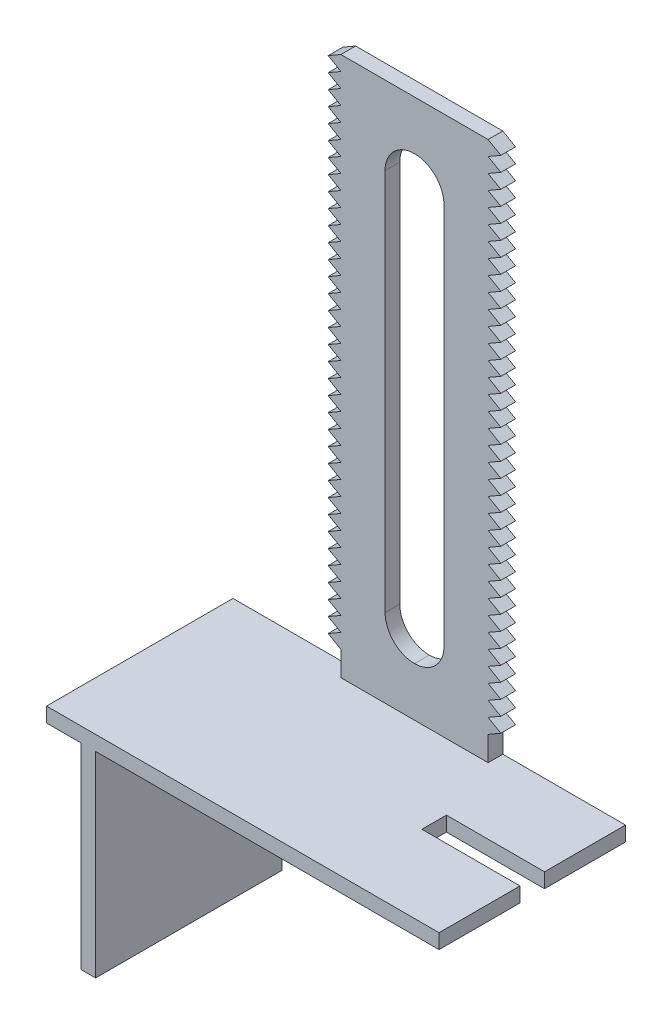
from build123d import *

# Parameters (mm, degrees)
SKETCH2_W            = 30
SKETCH2_H            = 3
BOSS_EXTRUDE1_DEPTH  = 110
BOSS_EXTRUDE2_DEPTH  = 3
SKETCH4_W            = 3
SKETCH4_H            = 3
BOSS_EXTRUDE3_DEPTH  = 3
SKETCH5_W            = 12
SKETCH5_H            = 90
CUT_EXTRUDE1_DEPTH   = 3
FILLET1_R            = 6
SKETCH7_W            = 3
SKETCH7_H            = 3
SKETCH7_W_2          = 6
BOSS_EXTRUDE8_DEPTH  = 10
SKETCH8_W            = 13
SKETCH8_H            = 3
BOSS_EXTRUDE9_DEPTH  = 3
SKETCH9_W            = 13
SKETCH9_H            = 3
BOSS_EXTRUDE10_DEPTH = 3
SKETCH10_W           = 13
SKETCH10_H           = 3
BOSS_EXTRUDE11_DEPTH = 3
SKETCH11_W           = 13
SKETCH11_H           = 3
BOSS_EXTRUDE12_DEPTH = 3
SKETCH12_W           = 13
SKETCH12_H           = 3
BOSS_EXTRUDE13_DEPTH = 25
SKETCH13_W           = 13
SKETCH13_H           = 3
BOSS_EXTRUDE14_DEPTH = 25
SKETCH14_W           = 80
SKETCH14_H           = 3
BOSS_EXTRUDE15_DEPTH = 25
SKETCH15_W           = 3
SKETCH15_H           = 38
BOSS_EXTRUDE16_DEPTH = 40
SKETCH16_W           = 20
SKETCH16_H           = 5
CUT_EXTRUDE2_DEPTH   = 3


with BuildPart() as part:
    # Sketch2 → Boss-Extrude1 (new body)
    with BuildSketch(Plane(origin=(0, 0, 0), x_dir=(1, 0, 0), z_dir=(0, 1, 0))):
        Rectangle(SKETCH2_W, SKETCH2_H)
    extrude(amount=BOSS_EXTRUDE1_DEPTH)

    # Sketch3 → Boss-Extrude2 (add)
    with BuildSketch(Plane.XY.offset(1.5)):
        Polygon((-15, 107), (-15, 110), (-17.598076211, 108.5), align=None)
        Polygon((-15, 104), (-15, 107), (-17.598076211, 105.5), align=None)
        Polygon((-15, 101), (-15, 104), (-17.598076211, 102.5), align=None)
        Polygon((-15, 98), (-15, 101), (-17.598076211, 99.5), align=None)
        Polygon((-15, 95), (-15, 98), (-17.598076211, 96.5), align=None)
        Polygon((-15, 92), (-15, 95), (-17.598076211, 93.5), align=None)
        Polygon((-15, 89), (-15, 92), (-17.598076211, 90.5), align=None)
        Polygon((-15, 86), (-15, 89), (-17.598076211, 87.5), align=None)
        Polygon((-15, 83), (-15, 86), (-17.598076211, 84.5), align=None)
        Polygon((-15, 80), (-15, 83), (-17.598076211, 81.5), align=None)
        Polygon((-15, 77), (-15, 80), (-17.598076211, 78.5), align=None)
        Polygon((17.598076211, 108.5), (15, 110), (15, 107), align=None)
        Polygon((17.598076211, 105.5), (15, 107), (15, 104), align=None)
        Polygon((17.598076211, 102.5), (15, 104), (15, 101), align=None)
        Polygon((17.598076211, 99.5), (15, 101), (15, 98), align=None)
        Polygon((17.598076211, 96.5), (15, 98), (15, 95), align=None)
        Polygon((17.598076211, 93.5), (15, 95), (15, 92), align=None)
        Polygon((17.598076211, 90.5), (15, 92), (15, 89), align=None)
        Polygon((17.598076211, 87.5), (15, 89), (15, 86), align=None)
        Polygon((17.598076211, 84.5), (15, 86), (15, 83), align=None)
        Polygon((17.598076211, 81.5), (15, 83), (15, 80), align=None)
        Polygon((17.598076211, 78.5), (15, 80), (15, 77), align=None)
        Polygon((-15, 74), (-15, 77), (-17.598076211, 75.5), align=None)
        Polygon((-15, 71), (-15, 74), (-17.598076211, 72.5), align=None)
        Polygon((-15, 68), (-15, 71), (-17.598076211, 69.5), align=None)
        Polygon((-15, 65), (-15, 68), (-17.598076211, 66.5), align=None)
        Polygon((-15, 62), (-15, 65), (-17.598076211, 63.5), align=None)
        Polygon((-15, 59), (-15, 62), (-17.598076211, 60.5), align=None)
        Polygon((-15, 56), (-15, 59), (-17.598076211, 57.5), align=None)
        Polygon((-15, 53), (-15, 56), (-17.598076211, 54.5), align=None)
        Polygon((-15, 50), (-15, 53), (-17.598076211, 51.5), align=None)
        Polygon((-15, 47), (-15, 50), (-17.598076211, 48.5), align=None)
        Polygon((-15, 44), (-15, 47), (-17.598076211, 45.5), align=None)
        Polygon((-15, 41), (-15, 44), (-17.598076211, 42.5), align=None)
        Polygon((-15, 38), (-15, 41), (-17.598076211, 39.5), align=None)
        Polygon((-15, 35), (-15, 38), (-17.598076211, 36.5), align=None)
        Polygon((17.598076211, 75.5), (15, 77), (15, 74), align=None)
        Polygon((17.598076211, 69.5), (15, 71), (15, 68), align=None)
        Polygon((17.598076211, 66.5), (15, 68), (15, 65), align=None)
        Polygon((17.598076211, 63.5), (15, 65), (15, 62), align=None)
        Polygon((17.598076211, 51.5), (15, 53), (15, 50), align=None)
        Polygon((17.598076211, 48.5), (15, 50), (15, 47), align=None)
        Polygon((17.598076211, 45.5), (15, 47), (15, 44), align=None)
        Polygon((17.598076211, 42.5), (15, 44), (15, 41), align=None)
        Polygon((17.598076211, 39.5), (15, 41), (15, 38), align=None)
        Polygon((17.598076211, 33.5), (15, 35), (15, 32), align=None)
        Polygon((17.598076211, 30.5), (15, 32), (15, 29), align=None)
        Polygon((-15, 32), (-15, 35), (-17.598076211, 33.5), align=None)
        Polygon((-15, 29), (-15, 32), (-17.598076211, 30.5), align=None)
        Polygon((-15, 26), (-15, 29), (-17.598076211, 27.5), align=None)
        Polygon((-15, 23), (-15, 26), (-17.598076211, 24.5), align=None)
        Polygon((-15, 20), (-15, 23), (-17.598076211, 21.5), align=None)
        Polygon((-15, 17), (-15, 20), (-17.598076211, 18.5), align=None)
        Polygon((17.598076211, 27.5), (15, 29), (15, 26), align=None)
        Polygon((17.598076211, 24.5), (15, 26), (15, 23), align=None)
        Polygon((-15, 14), (-15, 17), (-17.598076211, 15.5), align=None)
        Polygon((17.598076211, 21.5), (15, 23), (15, 20), align=None)
        Polygon((17.598076211, 18.5), (15, 20), (15, 17), align=None)
        Polygon((-15, 11), (-15, 14), (-17.598076211, 12.5), align=None)
        Polygon((17.598076211, 15.5), (15, 17), (15, 14), align=None)
        Polygon((17.598076211, 12.5), (15, 14), (15, 11), align=None)
        Polygon((17.598076211, 9.5), (15, 11), (15, 8), align=None)
        Polygon((17.598076211, 6.5), (15, 8), (15, 5), align=None)
        Polygon((-15, 5), (-15, 8), (-17.598076211, 6.5), align=None)
        Polygon((-15, 8), (-15, 11), (-17.598076211, 9.5), align=None)
        Polygon((15, 74), (17.598076211, 72.5), (15, 71), align=None)
        Polygon((15, 62), (17.598076211, 60.5), (15, 59), align=None)
        Polygon((15, 59), (17.598076211, 57.5), (15, 56), align=None)
        Polygon((15, 56), (17.598076211, 54.5), (15, 53), align=None)
        Polygon((15, 38), (17.598076211, 36.5), (15, 35), align=None)
    extrude(amount=-BOSS_EXTRUDE2_DEPTH)

    # Sketch4 → Boss-Extrude3 (add)
    with BuildSketch(Plane.XY.offset(1.5)):
        Polygon((-6, -3), (-9, -3), (-12, -3), (-15, -3), (-15, -6), (15, -6), (15, -3), (12, -3), (9, -3), (6, -3), (3, -3), (0, -3), (-3, -3), align=None)
        with Locations((-13.5, -1.5)):
            Rectangle(SKETCH4_W, SKETCH4_H)
        with Locations((-7.5, -1.5)):
            Rectangle(SKETCH4_W, SKETCH4_H)
        with Locations((-1.5, -1.5)):
            Rectangle(SKETCH4_W, SKETCH4_H)
        with Locations((1.5, -1.5)):
            Rectangle(SKETCH4_W, SKETCH4_H)
        with Locations((7.5, -1.5)):
            Rectangle(SKETCH4_W, SKETCH4_H)
        with Locations((13.5, -1.5)):
            Rectangle(SKETCH4_W, SKETCH4_H)
    extrude(amount=-BOSS_EXTRUDE3_DEPTH)

    # Sketch5 → Cut-Extrude1 (cut)
    with BuildSketch(Plane(origin=(0, 0, -1.5), x_dir=(-1, 0, 0), z_dir=(0, 0, -1))):
        with Locations((0, 55)):
            Rectangle(SKETCH5_W, SKETCH5_H)
    extrude(amount=-CUT_EXTRUDE1_DEPTH, mode=Mode.SUBTRACT)

    # Fillet1
    fillet1_edges = [part.edges().sort_by_distance(p)[0] for p in [
        (-6, 10, 0),
        (6, 10, 0),
        (6, 100, 0),
        (-6, 100, 0),
    ]]
    fillet(fillet1_edges, radius=FILLET1_R - 0.0001)  # a hair under: the kernel refuses the full size

    # Sketch7 → Boss-Extrude8 (add)
    with BuildSketch(Plane.XY.offset(1.5)):
        with Locations((-13.5, -1.5)):
            Rectangle(SKETCH7_W, SKETCH7_H)
        with Locations((-7.5, -1.5)):
            Rectangle(SKETCH7_W, SKETCH7_H)
        with Locations((0, -1.5)):
            Rectangle(SKETCH7_W_2, SKETCH7_H)
        with Locations((7.5, -1.5)):
            Rectangle(SKETCH7_W, SKETCH7_H)
        with Locations((13.5, -1.5)):
            Rectangle(SKETCH7_W, SKETCH7_H)
    extrude(amount=BOSS_EXTRUDE8_DEPTH)

    # Sketch8 → Boss-Extrude9 (add)
    with BuildSketch(Plane.ZY.offset(9)):
        with Locations((5, -1.5)):
            Rectangle(SKETCH8_W, SKETCH8_H)
    extrude(amount=BOSS_EXTRUDE9_DEPTH)

    # Sketch9 → Boss-Extrude10 (add)
    with BuildSketch(Plane.ZY.offset(3)):
        with Locations((5, -1.5)):
            Rectangle(SKETCH9_W, SKETCH9_H)
    extrude(amount=BOSS_EXTRUDE10_DEPTH)

    # Sketch10 → Boss-Extrude11 (add)
    with BuildSketch(Plane.ZY.offset(-6)):
        with Locations((5, -1.5)):
            Rectangle(SKETCH10_W, SKETCH10_H)
    extrude(amount=BOSS_EXTRUDE11_DEPTH)

    # Sketch11 → Boss-Extrude12 (add)
    with BuildSketch(Plane.ZY.offset(-12)):
        with Locations((5, -1.5)):
            Rectangle(SKETCH11_W, SKETCH11_H)
    extrude(amount=BOSS_EXTRUDE12_DEPTH)

    # Sketch12 → Boss-Extrude13 (add)
    with BuildSketch(Plane.ZY.offset(15)):
        with Locations((5, -1.5)):
            Rectangle(SKETCH12_W, SKETCH12_H)
    extrude(amount=BOSS_EXTRUDE13_DEPTH)

    # Sketch13 → Boss-Extrude14 (add)
    with BuildSketch(Plane(origin=(15, 0, 0), x_dir=(0, 0, -1), z_dir=(1, 0, 0))):
        with Locations((-5, -1.5)):
            Rectangle(SKETCH13_W, SKETCH13_H)
    extrude(amount=BOSS_EXTRUDE14_DEPTH)

    # Sketch14 → Boss-Extrude15 (add)
    with BuildSketch(Plane.XY.offset(11.5)):
        with Locations((0, -1.5)):
            Rectangle(SKETCH14_W, SKETCH14_H)
    extrude(amount=BOSS_EXTRUDE15_DEPTH)

    # Sketch15 → Boss-Extrude16 (add)
    with BuildSketch(Plane.XZ.offset(3)):
        with Locations((-31.5, 17.5)):
            Rectangle(SKETCH15_W, SKETCH15_H)
    extrude(amount=BOSS_EXTRUDE16_DEPTH)

    # Sketch16 → Cut-Extrude2 (cut)
    with BuildSketch(Plane.XZ.offset(3)):
        with Locations((30, 17.5)):
            Rectangle(SKETCH16_W, SKETCH16_H)
    extrude(amount=-CUT_EXTRUDE2_DEPTH, mode=Mode.SUBTRACT)


solid = part.part
